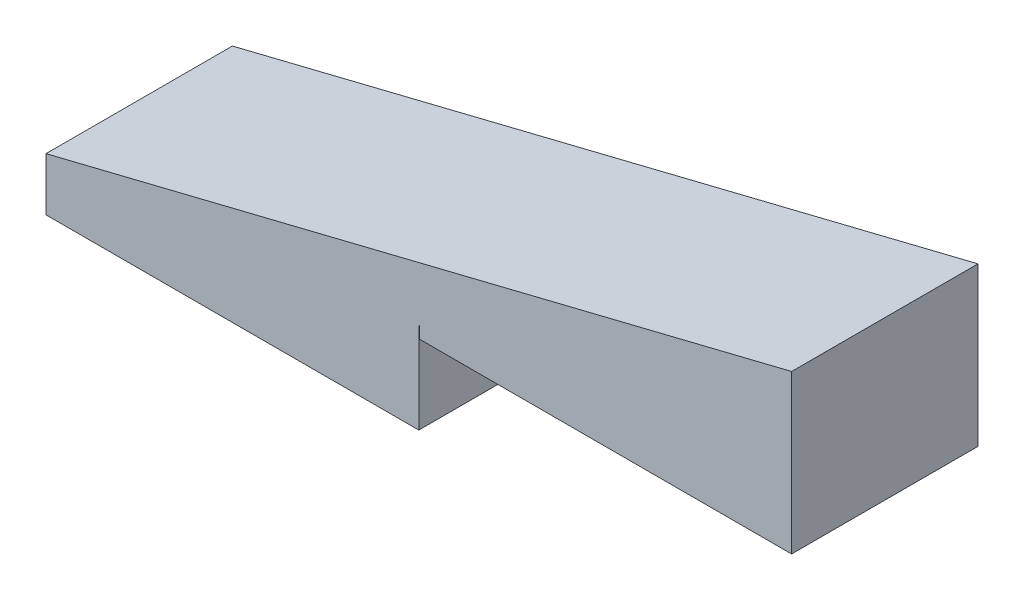
from build123d import *

# Parameters (mm, degrees)
MAINBASESKETCH_W          = 15.8
MAINBASESKETCH_H          = 3.2
MAINBASEEXTRUDE_DEPTH     = 7.9
STUDSSKETCH_R             = 2.4
STUDSEXTRUDE_DEPTH        = 1.6
MAINBASESHELL_T           = -1.2
LCUTBLUE_DEPTH            = 19.555463972
LCUTBLUE_DEPTH_BACK       = 19.555463972
CUTADDEDTOLCUT_DEPTH      = 2
MADESLIMCUTSKETCH_W       = 7.9
MADESLIMCUTSKETCH_H       = 7.9
MADESLIMCUT_DEPTH         = 19.897228453
ANGLEDSLIMBASECUT_DEPTH   = 19.555463972
ANGLEDSLIMBASESWEEP_DEPTH = 7.9
SKETCH147_W               = 5.500952983
SKETCH147_H               = 1.199047018
SWEEP27_DEPTH             = 7.9
SHELL9_START              = 1.2
SHELL9_DEPTH              = 5.5
BOSS_EXTRUDE21_START      = -0.2
BOSS_EXTRUDE21_DEPTH      = 1
BOSS_EXTRUDE21_2_DEPTH    = 1
BOSS_EXTRUDE21_3_DEPTH    = 1
BOSS_EXTRUDE21_4_DEPTH    = 1
BOSS_EXTRUDE22_START      = -1
BOSS_EXTRUDE22_DEPTH      = 1
BOSS_EXTRUDE22_2_DEPTH    = 1
BOSS_EXTRUDE22_3_DEPTH    = 1
BOSS_EXTRUDE22_4_DEPTH    = 1
BOSS_EXTRUDE24_DEPTH      = 0.5


# Read off the part's stored shape, not the designer's step: AngledSlimBaseSweep, Sweep27, Shell9
with BuildPart() as part:
    # MainBaseSketch → MainBaseExtrude (new, symmetric)
    with BuildSketch(Plane.XY):
        with Locations((8.581967213, 1.6)):
            Rectangle(MAINBASESKETCH_W, MAINBASESKETCH_H)
    extrude(amount=MAINBASEEXTRUDE_DEPTH, both=True)

    # StudsSketch → StudsExtrude (add)
    with BuildSketch(Plane(origin=(0, 3.2, 0), x_dir=(1, 0, 0), z_dir=(0, 1, 0))):
        with Locations((4.581967213, 4)):
            Circle(STUDSSKETCH_R)
    extrude(amount=STUDSEXTRUDE_DEPTH)

    # MainBaseShell
    mainbaseshell_openings = [part.faces().sort_by_distance(p)[0] for p in [
        (8.581967213, 0, 0),
    ]]
    offset(amount=MAINBASESHELL_T, openings=mainbaseshell_openings, kind=Kind.INTERSECTION)

    # LCUTBlueSketch → LCutBlue (cut, two sides: drawn at the far end of the back side and taken through both)
    with BuildSketch(Plane(origin=(0, 3.2, 0), x_dir=(1, 0, 0), z_dir=(0, 1, 0)).offset(-LCUTBLUE_DEPTH_BACK)):
        Polygon((8.581967213, 53.229874044), (8.581967213, 7.9), (8.581967213, 0), (16.481967213, 0), (61.811841258, 0), (125.917963912, 64.106122654), (72.688089868, 117.335996699), align=None)
    extrude(amount=LCUTBLUE_DEPTH + LCUTBLUE_DEPTH_BACK, mode=Mode.SUBTRACT)

    # CutAddedtoLSketch → CutAddedToLCut (add)
    with BuildSketch(Plane.XZ):
        Polygon((7.382920196, -6.7), (8.581967213, -6.7), (8.581967213, 0), (15.281967213, 0), (15.281967213, 1.199047018), (7.382920196, 1.199047018), (7.382920196, 0), align=None)
    extrude(amount=-CUTADDEDTOLCUT_DEPTH)

    # MadeSlimCutSketch → MadeSlimCut (cut, through all)
    with BuildSketch(Plane.XZ):
        with Locations((4.631967213, -3.95)):
            Rectangle(MADESLIMCUTSKETCH_W, MADESLIMCUTSKETCH_H)
    extrude(amount=-MADESLIMCUT_DEPTH, mode=Mode.SUBTRACT)

    # AngledSlimBaseSketch → AngledSlimBaseCut (cut, through all)
    with BuildSketch(Plane.XY.offset(7.9)):
        Polygon((16.481967213, 6.15), (0.681967213, 2.247699421), (16.481967213, 2.247699421), align=None)
    extrude(amount=-ANGLEDSLIMBASECUT_DEPTH, mode=Mode.SUBTRACT)


with BuildPart() as body_2:
    # of the pieces the cut leaves, the one that is kept (angledslimbasecut_keep)
    add(part.part.solids().sort_by_distance((0.681967213, 0, 7.9))[0])

    # AngledSlimBaseSweep outline → AngledSlimBaseSweep (add)
    with BuildSketch(Plane.XY):
        Polygon((16.481967213, 2.247699421), (16.481967213, 6.15), (0.681967213, 2.247699421), align=None)
    extrude(amount=ANGLEDSLIMBASESWEEP_DEPTH)

    # Sweep25: sweep along a curve in space
    with BuildLine() as sweep25_path:
        Line((7.382920196, 2, 1.199047018), (7.382920196, 0, 1.199047018))
    # Sketch147 → Sweep25 (sweep)
    with BuildSketch(Plane(origin=(0, 0, 0), x_dir=(-1, 0, 0), z_dir=(0, -1, 0))):
        with Locations((-4.632443704, -0.599523509)):
            Rectangle(SKETCH147_W, SKETCH147_H)
    sweep(path=sweep25_path.line)

    # Sweep27 outline → Sweep27 (add)
    with BuildSketch(Plane.XY):
        Polygon((32.281967213, 3.852300579), (32.281967213, 10.052300579), (16.481967213, 6.15), (16.481967213, 3.852300579), align=None)
    extrude(amount=SWEEP27_DEPTH)

    # Shell9 outline → Shell9 (cut)
    with BuildSketch(Plane.XY.offset(SHELL9_START)):
        Polygon((15.281967213, 3.2), (15.281967213, 3.852300579), (31.081967213, 3.852300579), (31.081967213, 8.51986528), (9.542398513, 3.2), align=None)
    extrude(amount=SHELL9_DEPTH, mode=Mode.SUBTRACT)

    # Sketch165 → Boss-Extrude24 (add)
    with BuildSketch(Plane(origin=(0, 3.852300579, 0), x_dir=(-1, 0, 0), z_dir=(0, -1, 0))):
        Polygon((-16.481967213, -1.2), (-16.481967213, 0), (-32.281967213, 0), (-32.281967213, -7.9), (-16.52114508, -7.9), (-16.52114508, -6.7), (-31.081967213, -6.7), (-31.081967213, -1.2), align=None)
    extrude(amount=BOSS_EXTRUDE24_DEPTH)


with BuildPart() as body_2_2:
    # Sketch163 → Boss-Extrude21 (new body)
    with BuildSketch(Plane(origin=(0, 0, 0), x_dir=(-1, 0, 0), z_dir=(0, -1, 0)).offset(BOSS_EXTRUDE21_START)):
        Polygon((-11.481967213, -1.201050686), (-11.481967213, -1.702890901), (-10.981967213, -2.202712708), (-10.481967213, -1.702890901), (-10.481967213, -1.201050686), align=None)
    extrude(amount=-BOSS_EXTRUDE21_DEPTH)


with BuildPart() as body_3:
    # Sketch163 → Boss-Extrude21 2 (new body)
    with BuildSketch(Plane(origin=(0, 0, 0), x_dir=(-1, 0, 0), z_dir=(0, -1, 0)).offset(BOSS_EXTRUDE21_START)):
        Polygon((-5.681967213, -1.702890901), (-6.181967213, -2.202712708), (-6.681967213, -1.702890901), (-6.681967213, -1.201050686), (-5.681967213, -1.201050686), align=None)
    extrude(amount=-BOSS_EXTRUDE21_2_DEPTH)


with BuildPart() as body_4:
    # Sketch163 → Boss-Extrude21 3 (new body)
    with BuildSketch(Plane(origin=(0, 0, 0), x_dir=(-1, 0, 0), z_dir=(0, -1, 0)).offset(BOSS_EXTRUDE21_START)):
        Polygon((-5.681967213, -6.697996332), (-5.681967213, -6.196156117), (-6.181967213, -5.69633431), (-6.681967213, -6.196156117), (-6.681967213, -6.697996332), align=None)
    extrude(amount=-BOSS_EXTRUDE21_3_DEPTH)


with BuildPart() as body_5:
    # Sketch163 → Boss-Extrude21 4 (new body)
    with BuildSketch(Plane(origin=(0, 0, 0), x_dir=(-1, 0, 0), z_dir=(0, -1, 0)).offset(BOSS_EXTRUDE21_START)):
        Polygon((-11.481967213, -6.697996332), (-10.481967213, -6.697996332), (-10.481967213, -6.196156117), (-10.981967213, -5.69633431), (-11.481967213, -6.196156117), align=None)
    extrude(amount=-BOSS_EXTRUDE21_4_DEPTH)


with BuildPart() as body_6:
    # Sketch164 → Boss-Extrude22 (new body)
    with BuildSketch(Plane(origin=(0, 3.852300579, 0), x_dir=(-1, 0, 0), z_dir=(0, -1, 0)).offset(BOSS_EXTRUDE22_START)):
        Polygon((-26.681967213, -1.21770137), (-26.681967213, -1.719541586), (-26.181967213, -2.219363392), (-25.681967213, -1.719541586), (-25.681967213, -1.21770137), align=None)
    extrude(amount=-BOSS_EXTRUDE22_DEPTH)


with BuildPart() as body_7:
    # Sketch164 → Boss-Extrude22 2 (new body)
    with BuildSketch(Plane(origin=(0, 3.852300579, 0), x_dir=(-1, 0, 0), z_dir=(0, -1, 0)).offset(BOSS_EXTRUDE22_START)):
        Polygon((-20.881967213, -1.719541586), (-21.381967213, -2.219363392), (-21.881967213, -1.719541586), (-21.881967213, -1.21770137), (-20.881967213, -1.21770137), align=None)
    extrude(amount=-BOSS_EXTRUDE22_2_DEPTH)


with BuildPart() as body_8:
    # Sketch164 → Boss-Extrude22 3 (new body)
    with BuildSketch(Plane(origin=(0, 3.852300579, 0), x_dir=(-1, 0, 0), z_dir=(0, -1, 0)).offset(BOSS_EXTRUDE22_START)):
        Polygon((-20.881814064, -6.681659566), (-20.881842196, -6.179819352), (-21.381870215, -5.680025575), (-21.881842195, -6.17987541), (-21.881814063, -6.681715624), align=None)
    extrude(amount=-BOSS_EXTRUDE22_3_DEPTH)


with BuildPart() as body_9:
    # Sketch164 → Boss-Extrude22 4 (new body)
    with BuildSketch(Plane(origin=(0, 3.852300579, 0), x_dir=(-1, 0, 0), z_dir=(0, -1, 0)).offset(BOSS_EXTRUDE22_START)):
        Polygon((-26.681814055, -6.681984702), (-25.681814057, -6.681928644), (-25.681842189, -6.180088429), (-26.181870207, -5.680294652), (-26.681842187, -6.180144487), align=None)
    extrude(amount=-BOSS_EXTRUDE22_4_DEPTH)


solid = Compound([body_2.part, body_2_2.part, body_3.part, body_4.part, body_5.part, body_6.part, body_7.part, body_8.part, body_9.part])
